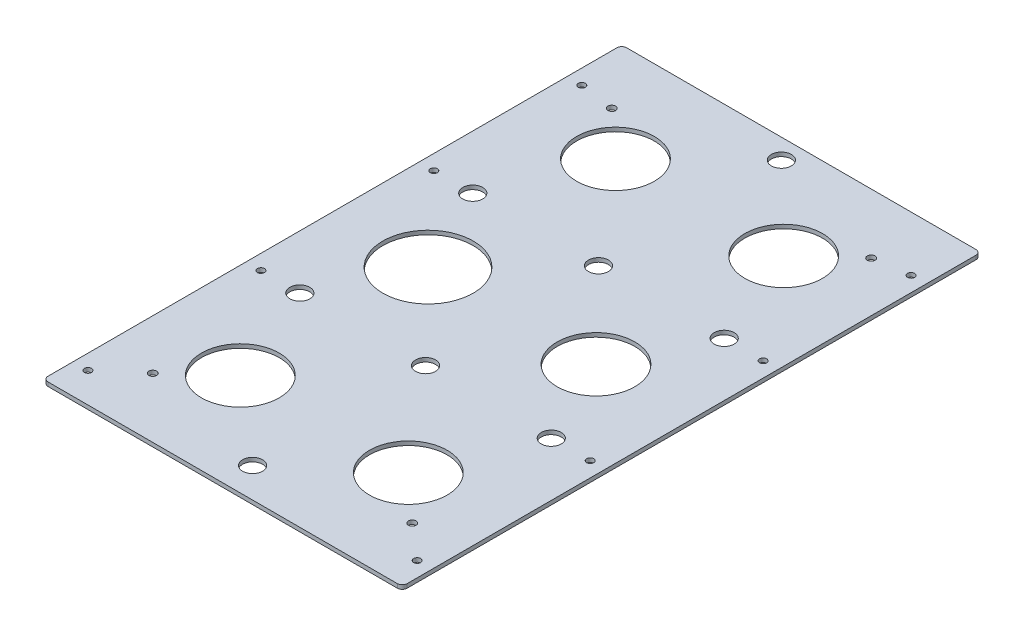
from build123d import *

# Parameters (mm, degrees)
SKETCH1_R           = 24.727
SKETCH1_R_2         = 28.76928198
SKETCH1_R_3         = 6.35
SKETCH1_R_4         = 2.45745
SKETCH1_R_5         = 2.2479
BOSS_EXTRUDE1_DEPTH = 2.54


with BuildPart() as part:
    # Sketch1 → Boss-Extrude1 (new body)
    with BuildSketch(Plane(origin=(0, 0, 0), x_dir=(1, 0, 0), z_dir=(0, 1, 0))):
        with BuildLine():
            Line((-56.121310552, -117.604731416), (166.128689448, -117.604731416))
            ThreePointArc((166.128689448, -117.604731416), (168.373753478, -118.534667386), (169.303689448, -120.779731416))
            Line((169.303689448, -120.779731416), (169.303689448, -482.729731416))
            ThreePointArc((169.303689448, -482.729731416), (168.373753478, -484.974795446), (166.128689448, -485.904731416))
            Line((166.128689448, -485.904731416), (-56.121310552, -485.904731416))
            ThreePointArc((-56.121310552, -485.904731416), (-58.366374582, -484.974795446), (-59.296310552, -482.729731416))
            Line((-59.296310552, -482.729731416), (-59.296310552, -120.779731416))
            ThreePointArc((-59.296310552, -120.779731416), (-58.366374582, -118.534667386), (-56.121310552, -117.604731416))
        make_face()
        with Locations((108.521489448, -421.2633131)):
            Circle(SKETCH1_R, mode=Mode.SUBTRACT)
        with Locations((108.521489448, -301.819022258)):
            Circle(SKETCH1_R, mode=Mode.SUBTRACT)
        with Locations((1.485889448, -421.134731416)):
            Circle(SKETCH1_R, mode=Mode.SUBTRACT)
        with Locations((1.485889448, -182.374731416)):
            Circle(SKETCH1_R, mode=Mode.SUBTRACT)
        with Locations((108.521489448, -182.374731416)):
            Circle(SKETCH1_R, mode=Mode.SUBTRACT)
        with Locations((1.485889448, -301.690440574)):
            Circle(SKETCH1_R_2, mode=Mode.SUBTRACT)
        with Locations((55.003689448, -466.854731416)):
            Circle(SKETCH1_R_3, mode=Mode.SUBTRACT)
        with Locations((135.013689448, -356.783831416)):
            Circle(SKETCH1_R_3, mode=Mode.SUBTRACT)
        with Locations((55.003689448, -356.788064749)):
            Circle(SKETCH1_R_3, mode=Mode.SUBTRACT)
        with Locations((-25.006310552, -356.783831416)):
            Circle(SKETCH1_R_3, mode=Mode.SUBTRACT)
        with Locations((135.013689448, -246.725631416)):
            Circle(SKETCH1_R_3, mode=Mode.SUBTRACT)
        with Locations((55.003689448, -246.721398083)):
            Circle(SKETCH1_R_3, mode=Mode.SUBTRACT)
        with Locations((-25.006310552, -246.725631416)):
            Circle(SKETCH1_R_3, mode=Mode.SUBTRACT)
        with Locations((55.003689448, -130.304731416)):
            Circle(SKETCH1_R_3, mode=Mode.SUBTRACT)
        with Locations((137.553689448, -155.704731416)):
            Circle(SKETCH1_R_4, mode=Mode.SUBTRACT)
        with Locations((-27.546310552, -155.704731416)):
            Circle(SKETCH1_R_4, mode=Mode.SUBTRACT)
        with Locations((-27.546310552, -447.804731416)):
            Circle(SKETCH1_R_4, mode=Mode.SUBTRACT)
        with Locations((137.553689448, -447.804731416)):
            Circle(SKETCH1_R_4, mode=Mode.SUBTRACT)
        with Locations((-49.771310552, -152.529731416)):
            Circle(SKETCH1_R_5, mode=Mode.SUBTRACT)
        with Locations((-49.771310552, -246.721398083)):
            Circle(SKETCH1_R_5, mode=Mode.SUBTRACT)
        with Locations((159.778689448, -152.529731416)):
            Circle(SKETCH1_R_5, mode=Mode.SUBTRACT)
        with Locations((159.778689448, -246.721398083)):
            Circle(SKETCH1_R_5, mode=Mode.SUBTRACT)
        with Locations((159.778689448, -356.788064749)):
            Circle(SKETCH1_R_5, mode=Mode.SUBTRACT)
        with Locations((-49.771310552, -356.788064749)):
            Circle(SKETCH1_R_5, mode=Mode.SUBTRACT)
        with Locations((-49.771310552, -466.854731416)):
            Circle(SKETCH1_R_5, mode=Mode.SUBTRACT)
        with Locations((159.778689448, -466.854731416)):
            Circle(SKETCH1_R_5, mode=Mode.SUBTRACT)
    extrude(amount=BOSS_EXTRUDE1_DEPTH)


solid = part.part
